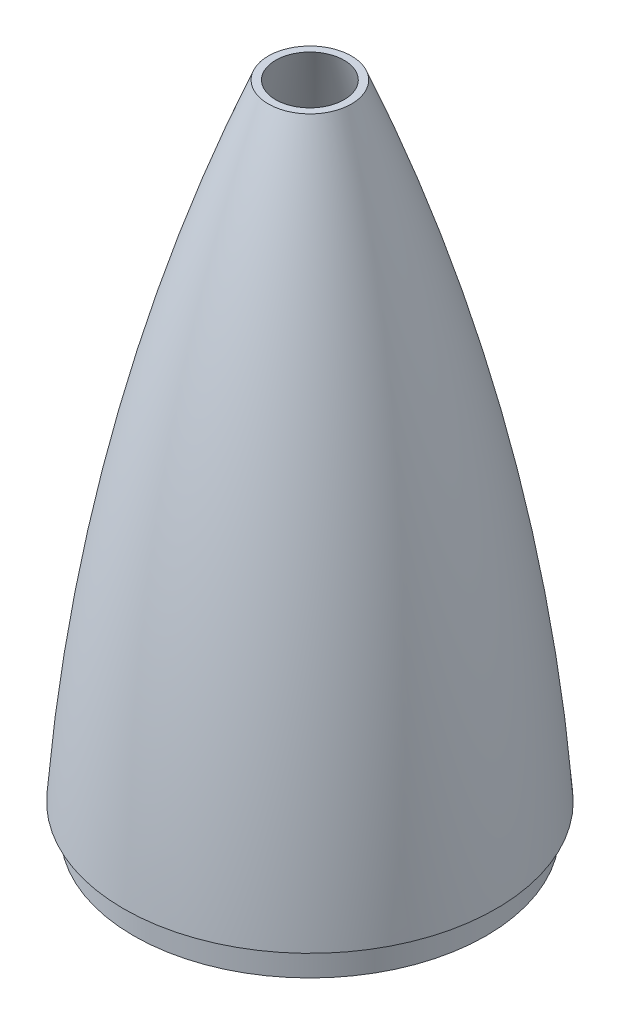
from build123d import *

# Parameters (mm, degrees)
SKETCH4_R           = 93.1545
SKETCH4_R_2         = 90.4875
BOSS_EXTRUDE2_DEPTH = 15
SKETCH7_R           = 317.5
CUT_EXTRUDE2_DEPTH  = 50.8


with BuildPart() as part:
    # Sketch2 → Revolve1 (revolve)
    with BuildSketch(Plane.XY):
        with BuildLine():
            Line((-98.425, 0), (-90.551, 0))
            ThreePointArc((-90.551, 0), (-60.43106349, 191.610647557), (0, 375.92))
            Line((0, 375.92), (0, 381))
            ThreePointArc((0, 381), (-66.494117829, 194.964417939), (-98.425, 0))
        make_face()
    revolve(axis=Axis((0, 381, 0), (0, -1, 0)))

    # Sketch4 → Boss-Extrude2 (add)
    with BuildSketch(Plane(origin=(0, 0, 0), x_dir=(-1, 0, 0), z_dir=(0, -1, 0))):
        Circle(SKETCH4_R)
        Circle(SKETCH4_R_2, mode=Mode.SUBTRACT)
    extrude(amount=BOSS_EXTRUDE2_DEPTH)

    # Sketch7 → Cut-Extrude2 (cut)
    with BuildSketch(Plane(origin=(0, 381, 0), x_dir=(1, 0, 0), z_dir=(0, 1, 0))):
        Circle(SKETCH7_R)
    extrude(amount=-CUT_EXTRUDE2_DEPTH, mode=Mode.SUBTRACT)


solid = part.part
